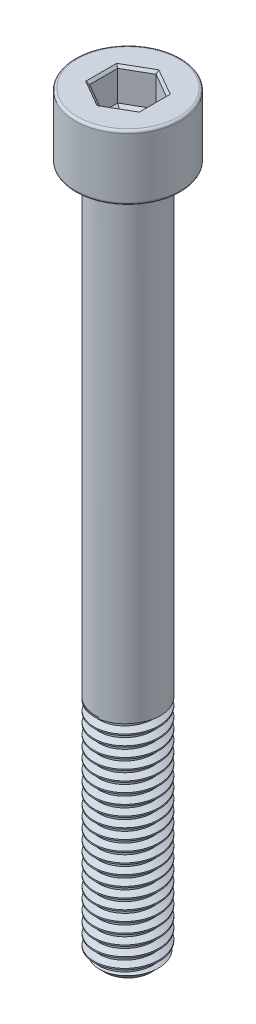
from build123d import *

# Parameters (mm, degrees)
SKETCH1_R           = 4
BOSS_EXTRUDE1_DEPTH = 28
THREAD1_PITCH       = 1.25
SKETCH2_R           = 4
BOSS_EXTRUDE2_DEPTH = 57
SKETCH5_R           = 6.5
BOSS_EXTRUDE3_DEPTH = 8
FILLET1_R           = 0.3
CUT_EXTRUDE1_DEPTH  = 4
CHAMFER1_SIZE       = 0.3
CUT_EXTRUDE2_DEPTH  = 0.4
CUT_EXTRUDE2_DRAFT  = -60


with BuildPart() as part:
    # Sketch1 → Boss-Extrude1 (new body)
    with BuildSketch(Plane(origin=(0, 0, 0), x_dir=(1, 0, 0), z_dir=(0, 1, 0))):
        with Locations(Location((0, 0, 0), (0, 0, 270))):
            Circle(SKETCH1_R)
    extrude(amount=BOSS_EXTRUDE1_DEPTH)

    # Thread1: the profile of Thread Profile1 profile screwed along a right-hand helix of 24 turns, 8 arcs to a turn; built about Z, then put on its axis
    thread1_z = Axis((0, 0, 0), (0, 0, 1))
    thread1_corners = [(4.0003, 0, -0.000173205), (4.0003, 0, 1.093923202), (3.323417656, 0, 0.703124998), (3.323417656, 0, 0.390624998)]
    with BuildLine(mode=Mode.PRIVATE) as thread1_profile:
        Line(thread1_corners[0], thread1_corners[1])
        Line(thread1_corners[1], thread1_corners[2])
        Line(thread1_corners[2], thread1_corners[3])
        Line(thread1_corners[3], thread1_corners[0])
    thread1_cap = Face(thread1_profile.wire())
    thread1_turn_angles = [0, 22.5, 45, 67.5, 90, 112.5, 135, 157.5, 180, 202.5, 225, 247.5, 270, 292.5, 315, 337.5, 360]
    thread1_turn_weights = [1, 0.9238795325112867, 1, 0.9238795325112867, 1, 0.9238795325112867, 1, 0.9238795325112867, 1, 0.9238795325112867, 1, 0.9238795325112867, 1, 0.9238795325112867, 1, 0.9238795325112867, 1]
    thread1_turn_rails = [Edge.make_bspline([Vector(p[0], p[1], 0).rotate(thread1_z, thread1_turn_angles[k]) / thread1_turn_weights[k] + Vector(0, 0, p[2] + THREAD1_PITCH * thread1_turn_angles[k] / 360) for k in range(17)], [0, 0, 0, 1, 1, 2, 2, 3, 3, 4, 4, 5, 5, 6, 6, 7, 7, 8, 8, 8], 2, thread1_turn_weights) for p in thread1_corners]
    thread1_turn_sides = [Face.make_surface_from_curves(thread1_turn_rails[p[0]], thread1_turn_rails[p[1]]) for p in [(0, 1), (1, 2), (2, 3), (3, 0)]]
    thread1 = Plane(origin=(0, 30, 0), x_dir=(-1, 0, 0), z_dir=(0, -1, 0)) * Solid(Shell([*[p.moved(Location((0, 0, THREAD1_PITCH * i))) for i in range(24) for p in thread1_turn_sides], thread1_cap, thread1_cap.rotate(thread1_z, 8640).moved(Location((0, 0, THREAD1_PITCH * 8640 / 360)))]))
    add(thread1, mode=Mode.SUBTRACT)

    # Sketch2 → Boss-Extrude2 (add)
    with BuildSketch(Plane(origin=(0, 28, 0), x_dir=(1, 0, 0), z_dir=(0, 1, 0))):
        with Locations(Location((0, 0, 0), (0, 0, 117.593571361))):
            Circle(SKETCH2_R)
    extrude(amount=BOSS_EXTRUDE2_DEPTH)

    # Sketch5 → Boss-Extrude3 (add)
    with BuildSketch(Plane(origin=(0, 85, 0), x_dir=(1, 0, 0), z_dir=(0, 1, 0))):
        with Locations(Location((0, 0, 0), (0, 0, 270))):
            Circle(SKETCH5_R)
    extrude(amount=BOSS_EXTRUDE3_DEPTH)

    # Sketch6 → Cut-Revolve1 (revolve, cut)
    with BuildSketch(Plane.XY, mode=Mode.PRIVATE) as cut_revolve1_sk:
        Polygon((4.01, 0), (4.01, 1.2), (2.81, 0), align=None)
    revolve(cut_revolve1_sk.sketch.rotate(Axis((0, 0, 0), (0, 1, 0)), 117.593571361), axis=Axis((0, 0, 0), (0, 1, 0)), mode=Mode.SUBTRACT)

    # Fillet1
    fillet1_edges = [part.edges().sort_by_distance(p)[0] for p in [
        (0, 85, -6.5),
        (0, 93, -6.5),
    ]]
    fillet(fillet1_edges, radius=FILLET1_R)

    # Sketch7 → Cut-Extrude1 (cut)
    with BuildSketch(Plane(origin=(0, 93, 0), x_dir=(1, 0, 0), z_dir=(0, 1, 0))):
        Polygon((0, 3.464101615), (-3, 1.732050808), (-3, -1.732050808), (0, -3.464101615), (3, -1.732050808), (3, 1.732050808), align=None)
    extrude(amount=-CUT_EXTRUDE1_DEPTH, mode=Mode.SUBTRACT)

    # Chamfer1
    chamfer1_edges = [part.edges().sort_by_distance(p)[0] for p in [
        (1.5, 93, -2.598076211),
        (-1.5, 93, -2.598076211),
        (-3, 93, 0),
        (-1.5, 93, 2.598076211),
        (1.5, 93, 2.598076211),
        (3, 93, 0),
    ]]
    chamfer(chamfer1_edges, length=CHAMFER1_SIZE)


with BuildPart() as cut_extrude2_tool:
    # Sketch8 → Cut-Extrude2 (with draft: the straight prism first)
    with BuildSketch(Plane(origin=(0, 89, 0), x_dir=(1, 0, 0), z_dir=(0, 1, 0))):
        Polygon((0, 3.464101615), (-3, 1.732050808), (-3, -1.732050808), (0, -3.464101615), (3, -1.732050808), (3, 1.732050808), align=None)
    extrude(amount=-CUT_EXTRUDE2_DEPTH)
    # Cut-Extrude2: the draft: its side faces are tilted about the plane it starts from
    cut_extrude2_sides = [cut_extrude2_tool.faces().sort_by_distance(p)[0] for p in [
        (-1.5, 88.8, -2.598076211),
        (-3, 88.8, 0),
        (-1.5, 88.8, 2.598076211),
        (1.5, 88.8, 2.598076211),
        (3, 88.8, 0),
        (1.5, 88.8, -2.598076211),
    ]]
    draft(cut_extrude2_sides, Plane(origin=(0, 89, 0), x_dir=(1, 0, 0), z_dir=(0, 1, 0)), CUT_EXTRUDE2_DRAFT)


with BuildPart() as part_1:
    add(part.part)

    # Cut-Extrude2: cut by cut_extrude2_tool
    add(cut_extrude2_tool.part, mode=Mode.SUBTRACT)


solid = part_1.part
